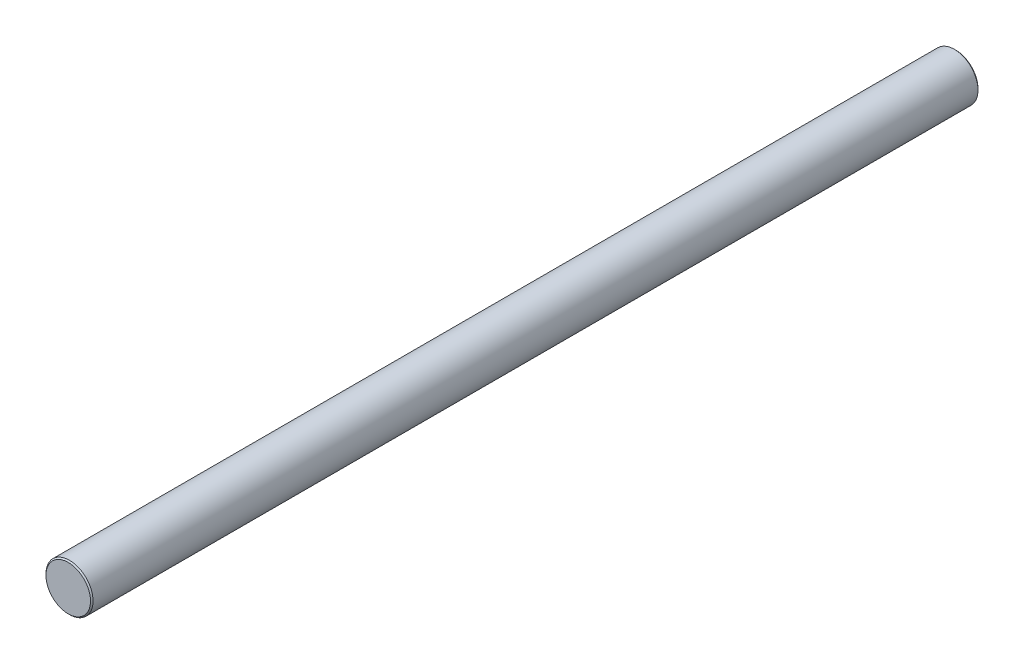
from build123d import *

# Parameters (mm, degrees)
SKETCH1_R           = 4.7625
BOSS_EXTRUDE1_DEPTH = 179.5526
CHAMFER1_SIZE       = 0.254


with BuildPart() as part:
    # Sketch1 → Boss-Extrude1 (new body)
    with BuildSketch(Plane.XY):
        Circle(SKETCH1_R)
    extrude(amount=BOSS_EXTRUDE1_DEPTH)

    # Chamfer1
    chamfer1_edges = [part.edges().sort_by_distance(p)[0] for p in [
        (-4.7625, 0, 179.5526),
        (-4.7625, 0, 0),
    ]]
    chamfer(chamfer1_edges, length=CHAMFER1_SIZE)


solid = part.part
